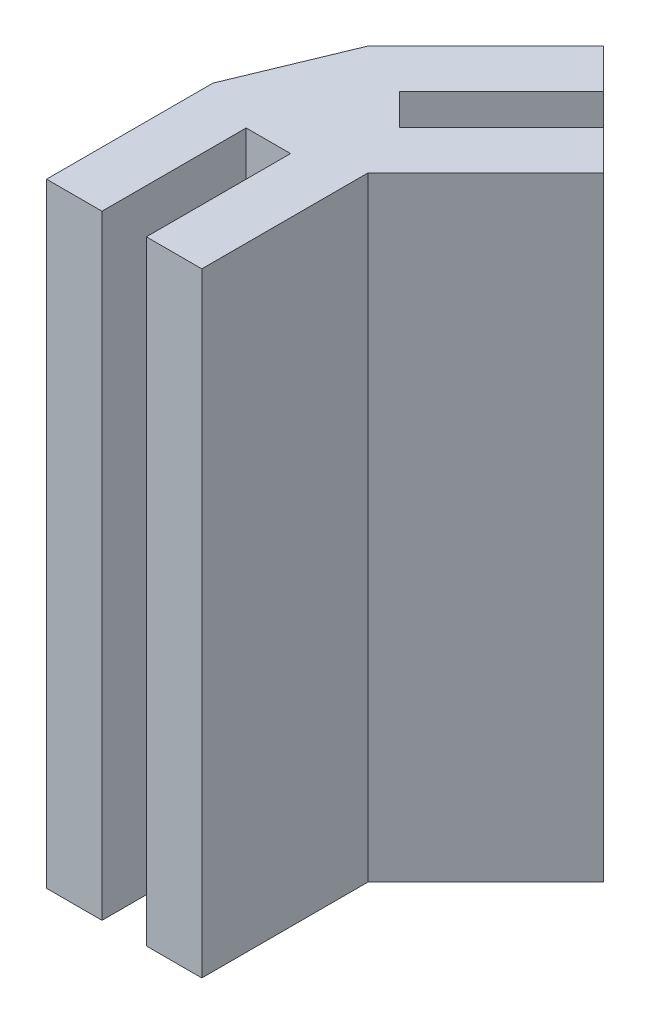
from build123d import *

# Parameters (mm, degrees)
BOSS_EXTRUDE1_DEPTH = 55.374093082
CHAMFER1_START      = -16
CHAMFER1_OUTLINE_W  = 58
CHAMFER1_OUTLINE_H  = 14
CHAMFER1_DEPTH      = 3.065686545


with BuildPart() as part:
    # Sketch2 → Boss-Extrude1 (new body)
    with BuildSketch(Plane(origin=(0, 0, 0), x_dir=(1, 0, 0), z_dir=(0, 1, 0))):
        Polygon((0, 0), (0, -15), (-5, -15), (-5, -2), (-9, -2), (-9, -15), (-14, -15), (-14, 5.798989873), align=None)
    boss_extrude1 = extrude(amount=BOSS_EXTRUDE1_DEPTH)

    # Mirror2: Boss-Extrude1 across plane
    add(boss_extrude1.mirror(Plane(origin=(0, 55.374093082, 0), x_dir=(0.9238795325112891, 0, 0.382683432365084), z_dir=(-0.382683432365084, 0, 0.9238795325112892))))

    # Chamfer1: read off the stored shape, not the designer's step
    # Chamfer1 outline → Chamfer1 (cut)
    with BuildSketch(Plane(origin=(0, 0, 0), x_dir=(0, 1, 0), z_dir=(0.9238795325112892, 0, 0.3826834323650841)).offset(CHAMFER1_START)):
        with Locations((28, 0)):
            Rectangle(CHAMFER1_OUTLINE_W, CHAMFER1_OUTLINE_H)
    extrude(amount=CHAMFER1_DEPTH, mode=Mode.SUBTRACT)


solid = part.part
